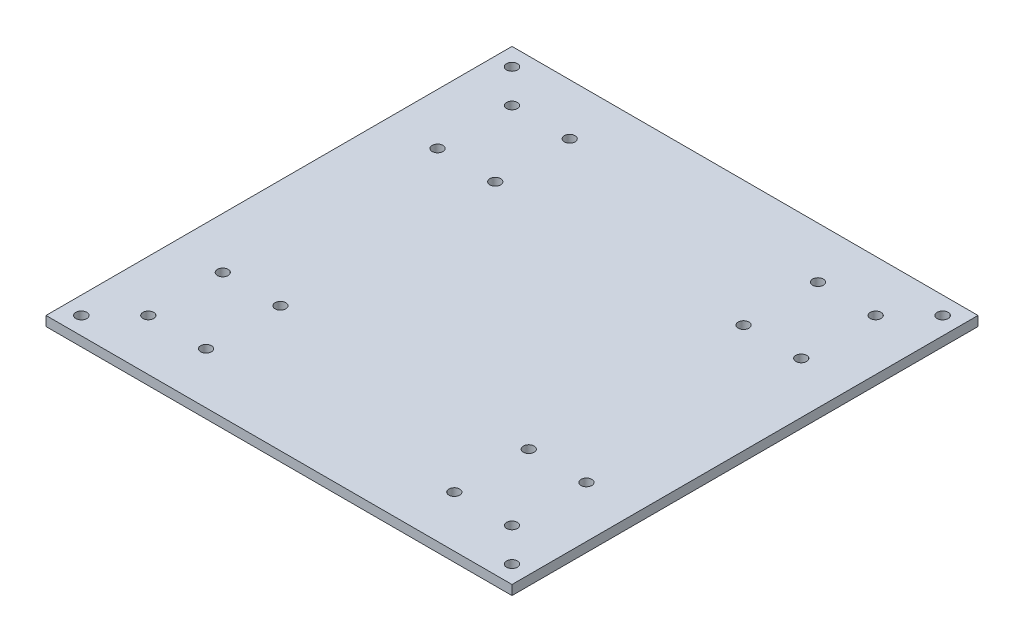
from build123d import *

# Parameters (mm, degrees)
SKETCH1_W           = 145
SKETCH1_H           = 145
BOSS_EXTRUDE1_DEPTH = 3
SKETCH2_R           = 1.705
CUT_EXTRUDE1_DEPTH  = 206.082910063
SKETCH3_R           = 1.675
CUT_EXTRUDE2_DEPTH  = 206.082910063


with BuildPart() as part:
    # Sketch1 → Boss-Extrude1 (new body)
    with BuildSketch(Plane(origin=(0, 0, 0), x_dir=(1, 0, 0), z_dir=(0, 1, 0))):
        with Locations((72.5, 72.5)):
            Rectangle(SKETCH1_W, SKETCH1_H)
    extrude(amount=BOSS_EXTRUDE1_DEPTH)

    # Sketch2 → Cut-Extrude1 (cut, through all)
    with BuildSketch(Plane(origin=(0, 3, 0), x_dir=(1, 0, 0), z_dir=(0, 1, 0))):
        with Locations((5.5, 5.5)):
            Circle(SKETCH2_R)
        with Locations((139.5, 5.5)):
            Circle(SKETCH2_R)
        with Locations((5.5, 139.5)):
            Circle(SKETCH2_R)
        with Locations((139.5, 139.5)):
            Circle(SKETCH2_R)
    extrude(amount=-CUT_EXTRUDE1_DEPTH, mode=Mode.SUBTRACT)

    # Sketch3 → Cut-Extrude2 (cut, through all)
    with BuildSketch(Plane(origin=(0, 3, 0), x_dir=(1, 0, 0), z_dir=(0, 1, 0))):
        with Locations((15.92, 15.92)):
            Circle(SKETCH3_R)
        with Locations((33.87, 15.92)):
            Circle(SKETCH3_R)
        with Locations((15.92, 39.08)):
            Circle(SKETCH3_R)
        with Locations((33.87, 39.08)):
            Circle(SKETCH3_R)
        with Locations((33.87, 105.92)):
            Circle(SKETCH3_R)
        with Locations((15.92, 105.92)):
            Circle(SKETCH3_R)
        with Locations((33.87, 129.08)):
            Circle(SKETCH3_R)
        with Locations((15.92, 129.08)):
            Circle(SKETCH3_R)
        with Locations((111.13, 39.08)):
            Circle(SKETCH3_R)
        with Locations((129.08, 39.08)):
            Circle(SKETCH3_R)
        with Locations((111.13, 15.92)):
            Circle(SKETCH3_R)
        with Locations((129.08, 15.92)):
            Circle(SKETCH3_R)
        with Locations((129.08, 129.08)):
            Circle(SKETCH3_R)
        with Locations((111.13, 129.08)):
            Circle(SKETCH3_R)
        with Locations((129.08, 105.92)):
            Circle(SKETCH3_R)
        with Locations((111.13, 105.92)):
            Circle(SKETCH3_R)
    extrude(amount=-CUT_EXTRUDE2_DEPTH, mode=Mode.SUBTRACT)


solid = part.part
